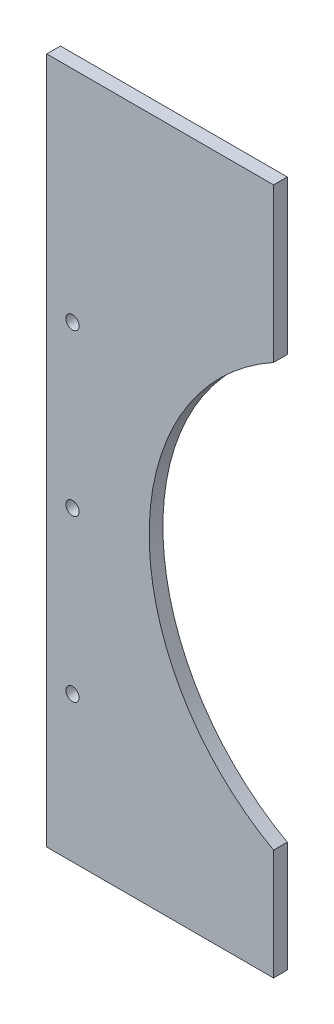
from build123d import *

# Parameters (mm, degrees)
BOSS_EXTRUDE1_DEPTH              = 11.90625
F_29_64_0_45313_DIAMETER_HOLE1_D = 11.509502


with BuildPart() as part:
    # Sketch1 → Boss-Extrude1 (new body)
    with BuildSketch(Plane.XY):
        with BuildLine():
            Line((-43.99439333, 113.616800302), (152.85560667, 113.616800302))
            Line((152.85560667, 113.616800302), (152.85560667, -19.849154639))
            ThreePointArc((152.85560667, -19.849154639), (44.90560667, -203.121199698), (152.85560667, -386.393244757))
            Line((152.85560667, -386.393244757), (152.85560667, -482.521199698))
            Line((152.85560667, -482.521199698), (-43.99439333, -482.521199698))
            Line((-43.99439333, -482.521199698), (-43.99439333, 113.616800302))
        make_face()
    extrude(amount=BOSS_EXTRUDE1_DEPTH)

    # 29/64 (0.45313) Diameter Hole1 (through all)
    with Locations(Plane.XY.offset(11.90625)):
        with Locations((-21.64239333, -76.883199698), (-21.64239333, -216.583199698), (-21.64239333, -356.283199698)):
            Hole(F_29_64_0_45313_DIAMETER_HOLE1_D / 2)


solid = part.part
